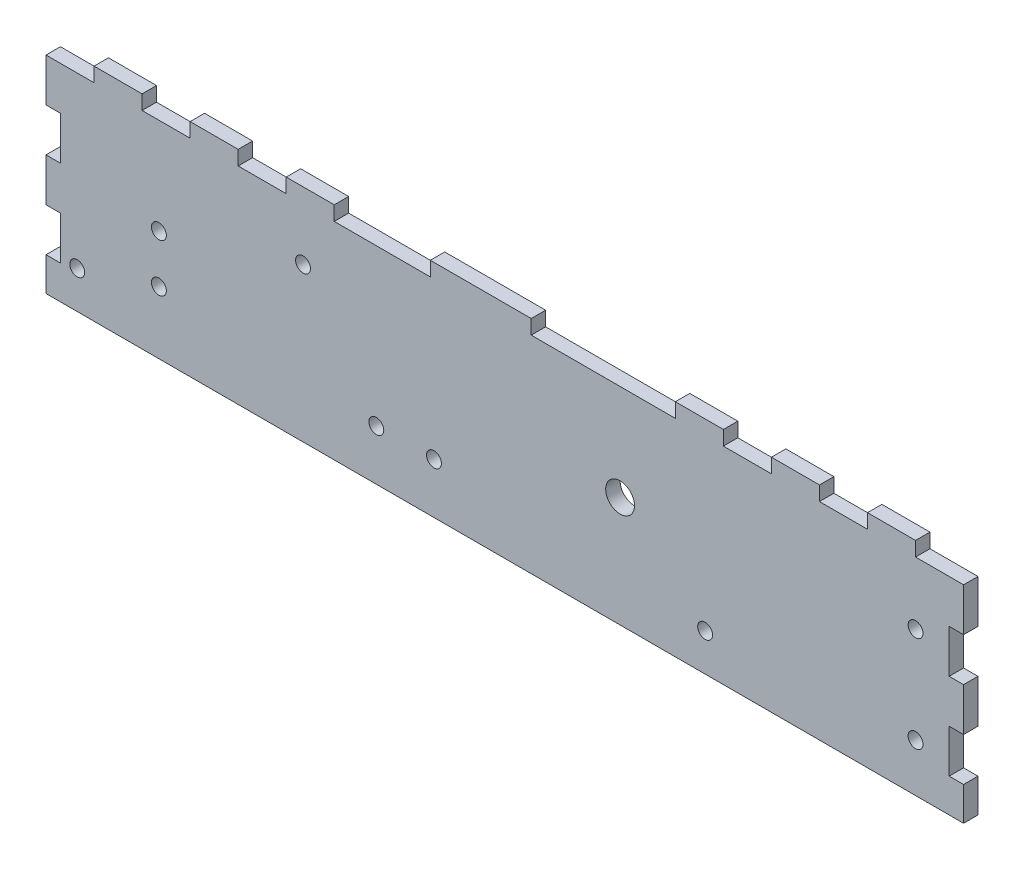
from build123d import *

# Parameters (mm, degrees)
SKETCH1_W           = 191
SKETCH1_H           = 46
SKETCH1_R           = 1.549999948
BOSS_EXTRUDE1_DEPTH = 3
CUT_EXTRUDE1_REACH  = 198.484
SKETCH4_W           = 10
SKETCH4_H           = 3
SKETCH4_W_2         = 20
SKETCH4_W_3         = 30
CUT_EXTRUDE2_REACH  = 198.484
SKETCH5_W           = 3
SKETCH5_H           = 9
CUT_EXTRUDE3_REACH  = 198.484
SKETCH6_W           = 3
SKETCH6_H           = 9
CUT_EXTRUDE4_REACH  = 198.484
SKETCH7_R           = 3
CUT_EXTRUDE5_REACH  = 198.484
SKETCH8_R           = 1.55
CUT_EXTRUDE6_REACH  = 198.484
SKETCH9_R           = 1.55


with BuildPart() as part:
    # Sketch1 → Boss-Extrude1 (new body)
    with BuildSketch(Plane.XY):
        with Locations((95.5, 23)):
            Rectangle(SKETCH1_W, SKETCH1_H)
        with Locations((181, 30)):
            Circle(SKETCH1_R, mode=Mode.SUBTRACT)
        with Locations((181, 10)):
            Circle(SKETCH1_R, mode=Mode.SUBTRACT)
    extrude(amount=BOSS_EXTRUDE1_DEPTH)

    # Sketch4 → Cut-Extrude1 (cut, up to next)
    with BuildSketch(Plane(origin=(0, 0, 0), x_dir=(-1, 0, 0), z_dir=(0, 0, -1)), mode=Mode.PRIVATE) as cut_extrude1_sk1:
        with Locations((-5, 44.5)):
            Rectangle(SKETCH4_W, SKETCH4_H)
    cut_extrude1_tool1 = extrude(cut_extrude1_sk1.sketch, amount=-CUT_EXTRUDE1_REACH, mode=Mode.PRIVATE) & part.part
    # Sketch4 → Cut-Extrude1 (cut, up to next)
    with BuildSketch(Plane(origin=(0, 0, 0), x_dir=(-1, 0, 0), z_dir=(0, 0, -1)), mode=Mode.PRIVATE) as cut_extrude1_sk2:
        with Locations((-25, 44.5)):
            Rectangle(SKETCH4_W, SKETCH4_H)
    cut_extrude1_tool2 = extrude(cut_extrude1_sk2.sketch, amount=-CUT_EXTRUDE1_REACH, mode=Mode.PRIVATE) & part.part
    # Sketch4 → Cut-Extrude1 (cut, up to next)
    with BuildSketch(Plane(origin=(0, 0, 0), x_dir=(-1, 0, 0), z_dir=(0, 0, -1)), mode=Mode.PRIVATE) as cut_extrude1_sk3:
        with Locations((-45, 44.5)):
            Rectangle(SKETCH4_W, SKETCH4_H)
    cut_extrude1_tool3 = extrude(cut_extrude1_sk3.sketch, amount=-CUT_EXTRUDE1_REACH, mode=Mode.PRIVATE) & part.part
    # Sketch4 → Cut-Extrude1 (cut, up to next)
    with BuildSketch(Plane(origin=(0, 0, 0), x_dir=(-1, 0, 0), z_dir=(0, 0, -1)), mode=Mode.PRIVATE) as cut_extrude1_sk4:
        with Locations((-70, 44.5)):
            Rectangle(SKETCH4_W_2, SKETCH4_H)
    cut_extrude1_tool4 = extrude(cut_extrude1_sk4.sketch, amount=-CUT_EXTRUDE1_REACH, mode=Mode.PRIVATE) & part.part
    # Sketch4 → Cut-Extrude1 (cut, up to next)
    with BuildSketch(Plane(origin=(0, 0, 0), x_dir=(-1, 0, 0), z_dir=(0, 0, -1)), mode=Mode.PRIVATE) as cut_extrude1_sk5:
        with Locations((-116, 44.5)):
            Rectangle(SKETCH4_W_3, SKETCH4_H)
    cut_extrude1_tool5 = extrude(cut_extrude1_sk5.sketch, amount=-CUT_EXTRUDE1_REACH, mode=Mode.PRIVATE) & part.part
    # Sketch4 → Cut-Extrude1 (cut, up to next)
    with BuildSketch(Plane(origin=(0, 0, 0), x_dir=(-1, 0, 0), z_dir=(0, 0, -1)), mode=Mode.PRIVATE) as cut_extrude1_sk6:
        with Locations((-146, 44.5)):
            Rectangle(SKETCH4_W, SKETCH4_H)
    cut_extrude1_tool6 = extrude(cut_extrude1_sk6.sketch, amount=-CUT_EXTRUDE1_REACH, mode=Mode.PRIVATE) & part.part
    # Sketch4 → Cut-Extrude1 (cut, up to next)
    with BuildSketch(Plane(origin=(0, 0, 0), x_dir=(-1, 0, 0), z_dir=(0, 0, -1)), mode=Mode.PRIVATE) as cut_extrude1_sk7:
        with Locations((-166, 44.5)):
            Rectangle(SKETCH4_W, SKETCH4_H)
    cut_extrude1_tool7 = extrude(cut_extrude1_sk7.sketch, amount=-CUT_EXTRUDE1_REACH, mode=Mode.PRIVATE) & part.part
    # Sketch4 → Cut-Extrude1 (cut, up to next)
    with BuildSketch(Plane(origin=(0, 0, 0), x_dir=(-1, 0, 0), z_dir=(0, 0, -1)), mode=Mode.PRIVATE) as cut_extrude1_sk8:
        with Locations((-186, 44.5)):
            Rectangle(SKETCH4_W, SKETCH4_H)
    cut_extrude1_tool8 = extrude(cut_extrude1_sk8.sketch, amount=-CUT_EXTRUDE1_REACH, mode=Mode.PRIVATE) & part.part
    add(cut_extrude1_tool1.solids().sort_by_distance((5, 44.5, 0))[0], mode=Mode.SUBTRACT)
    add(cut_extrude1_tool2.solids().sort_by_distance((25, 44.5, 0))[0], mode=Mode.SUBTRACT)
    add(cut_extrude1_tool3.solids().sort_by_distance((45, 44.5, 0))[0], mode=Mode.SUBTRACT)
    add(cut_extrude1_tool4.solids().sort_by_distance((70, 44.5, 0))[0], mode=Mode.SUBTRACT)
    add(cut_extrude1_tool5.solids().sort_by_distance((116, 44.5, 0))[0], mode=Mode.SUBTRACT)
    add(cut_extrude1_tool6.solids().sort_by_distance((146, 44.5, 0))[0], mode=Mode.SUBTRACT)
    add(cut_extrude1_tool7.solids().sort_by_distance((166, 44.5, 0))[0], mode=Mode.SUBTRACT)
    add(cut_extrude1_tool8.solids().sort_by_distance((186, 44.5, 0))[0], mode=Mode.SUBTRACT)

    # Sketch5 → Cut-Extrude2 (cut, up to next)
    with BuildSketch(Plane(origin=(0, 0, 0), x_dir=(-1, 0, 0), z_dir=(0, 0, -1)), mode=Mode.PRIVATE) as cut_extrude2_sk1:
        with Locations((-1.5, 29.5)):
            Rectangle(SKETCH5_W, SKETCH5_H)
    cut_extrude2_tool1 = extrude(cut_extrude2_sk1.sketch, amount=-CUT_EXTRUDE2_REACH, mode=Mode.PRIVATE) & part.part
    # Sketch5 → Cut-Extrude2 (cut, up to next)
    with BuildSketch(Plane(origin=(0, 0, 0), x_dir=(-1, 0, 0), z_dir=(0, 0, -1)), mode=Mode.PRIVATE) as cut_extrude2_sk2:
        with Locations((-1.5, 11.5)):
            Rectangle(SKETCH5_W, SKETCH5_H)
    cut_extrude2_tool2 = extrude(cut_extrude2_sk2.sketch, amount=-CUT_EXTRUDE2_REACH, mode=Mode.PRIVATE) & part.part
    add(cut_extrude2_tool1.solids().sort_by_distance((1.5, 29.5, 0))[0], mode=Mode.SUBTRACT)
    add(cut_extrude2_tool2.solids().sort_by_distance((1.5, 11.5, 0))[0], mode=Mode.SUBTRACT)

    # Sketch6 → Cut-Extrude3 (cut, up to next)
    with BuildSketch(Plane(origin=(0, 0, 0), x_dir=(-1, 0, 0), z_dir=(0, 0, -1)), mode=Mode.PRIVATE) as cut_extrude3_sk1:
        with Locations((-189.5, 29.5)):
            Rectangle(SKETCH6_W, SKETCH6_H)
    cut_extrude3_tool1 = extrude(cut_extrude3_sk1.sketch, amount=-CUT_EXTRUDE3_REACH, mode=Mode.PRIVATE) & part.part
    # Sketch6 → Cut-Extrude3 (cut, up to next)
    with BuildSketch(Plane(origin=(0, 0, 0), x_dir=(-1, 0, 0), z_dir=(0, 0, -1)), mode=Mode.PRIVATE) as cut_extrude3_sk2:
        with Locations((-189.5, 11.5)):
            Rectangle(SKETCH6_W, SKETCH6_H)
    cut_extrude3_tool2 = extrude(cut_extrude3_sk2.sketch, amount=-CUT_EXTRUDE3_REACH, mode=Mode.PRIVATE) & part.part
    add(cut_extrude3_tool1.solids().sort_by_distance((189.5, 29.5, 0))[0], mode=Mode.SUBTRACT)
    add(cut_extrude3_tool2.solids().sort_by_distance((189.5, 11.5, 0))[0], mode=Mode.SUBTRACT)

    # Sketch7 → Cut-Extrude4 (cut, up to next)
    with BuildSketch(Plane.XY.offset(3), mode=Mode.PRIVATE) as cut_extrude4_sk1:
        with Locations((119.5, 23)):
            Circle(SKETCH7_R)
    cut_extrude4_tool1 = extrude(cut_extrude4_sk1.sketch, amount=-CUT_EXTRUDE4_REACH, mode=Mode.PRIVATE) & part.part
    add(cut_extrude4_tool1.solids().sort_by_distance((119.5, 23, 3))[0], mode=Mode.SUBTRACT)

    # Sketch8 → Cut-Extrude5 (cut, up to next)
    with BuildSketch(Plane.XY.offset(3), mode=Mode.PRIVATE) as cut_extrude5_sk1:
        with Locations((23.5, 13)):
            Circle(SKETCH8_R)
    cut_extrude5_tool1 = extrude(cut_extrude5_sk1.sketch, amount=-CUT_EXTRUDE5_REACH, mode=Mode.PRIVATE) & part.part
    # Sketch8 → Cut-Extrude5 (cut, up to next)
    with BuildSketch(Plane.XY.offset(3), mode=Mode.PRIVATE) as cut_extrude5_sk2:
        with Locations((23.5, 23)):
            Circle(SKETCH8_R)
    cut_extrude5_tool2 = extrude(cut_extrude5_sk2.sketch, amount=-CUT_EXTRUDE5_REACH, mode=Mode.PRIVATE) & part.part
    # Sketch8 → Cut-Extrude5 (cut, up to next)
    with BuildSketch(Plane.XY.offset(3), mode=Mode.PRIVATE) as cut_extrude5_sk3:
        with Locations((53.5, 32)):
            Circle(SKETCH8_R)
    cut_extrude5_tool3 = extrude(cut_extrude5_sk3.sketch, amount=-CUT_EXTRUDE5_REACH, mode=Mode.PRIVATE) & part.part
    # Sketch8 → Cut-Extrude5 (cut, up to next)
    with BuildSketch(Plane.XY.offset(3), mode=Mode.PRIVATE) as cut_extrude5_sk4:
        with Locations((68.757359313, 10.5)):
            Circle(SKETCH8_R)
    cut_extrude5_tool4 = extrude(cut_extrude5_sk4.sketch, amount=-CUT_EXTRUDE5_REACH, mode=Mode.PRIVATE) & part.part
    # Sketch8 → Cut-Extrude5 (cut, up to next)
    with BuildSketch(Plane.XY.offset(3), mode=Mode.PRIVATE) as cut_extrude5_sk5:
        with Locations((80.757359313, 10.5)):
            Circle(SKETCH8_R)
    cut_extrude5_tool5 = extrude(cut_extrude5_sk5.sketch, amount=-CUT_EXTRUDE5_REACH, mode=Mode.PRIVATE) & part.part
    add(cut_extrude5_tool1.solids().sort_by_distance((23.5, 13, 3))[0], mode=Mode.SUBTRACT)
    add(cut_extrude5_tool2.solids().sort_by_distance((23.5, 23, 3))[0], mode=Mode.SUBTRACT)
    add(cut_extrude5_tool3.solids().sort_by_distance((53.5, 32, 3))[0], mode=Mode.SUBTRACT)
    add(cut_extrude5_tool4.solids().sort_by_distance((68.757359, 10.5, 3))[0], mode=Mode.SUBTRACT)
    add(cut_extrude5_tool5.solids().sort_by_distance((80.757359, 10.5, 3))[0], mode=Mode.SUBTRACT)

    # Sketch9 → Cut-Extrude6 (cut, up to next)
    with BuildSketch(Plane(origin=(0, 0, 0), x_dir=(-1, 0, 0), z_dir=(0, 0, -1)), mode=Mode.PRIVATE) as cut_extrude6_sk1:
        with Locations((-137.2, 7.8)):
            Circle(SKETCH9_R)
    cut_extrude6_tool1 = extrude(cut_extrude6_sk1.sketch, amount=-CUT_EXTRUDE6_REACH, mode=Mode.PRIVATE) & part.part
    # Sketch9 → Cut-Extrude6 (cut, up to next)
    with BuildSketch(Plane(origin=(0, 0, 0), x_dir=(-1, 0, 0), z_dir=(0, 0, -1)), mode=Mode.PRIVATE) as cut_extrude6_sk2:
        with Locations((-6.5, 7.8)):
            Circle(SKETCH9_R)
    cut_extrude6_tool2 = extrude(cut_extrude6_sk2.sketch, amount=-CUT_EXTRUDE6_REACH, mode=Mode.PRIVATE) & part.part
    add(cut_extrude6_tool1.solids().sort_by_distance((137.2, 7.8, 0))[0], mode=Mode.SUBTRACT)
    add(cut_extrude6_tool2.solids().sort_by_distance((6.5, 7.8, 0))[0], mode=Mode.SUBTRACT)


solid = part.part
